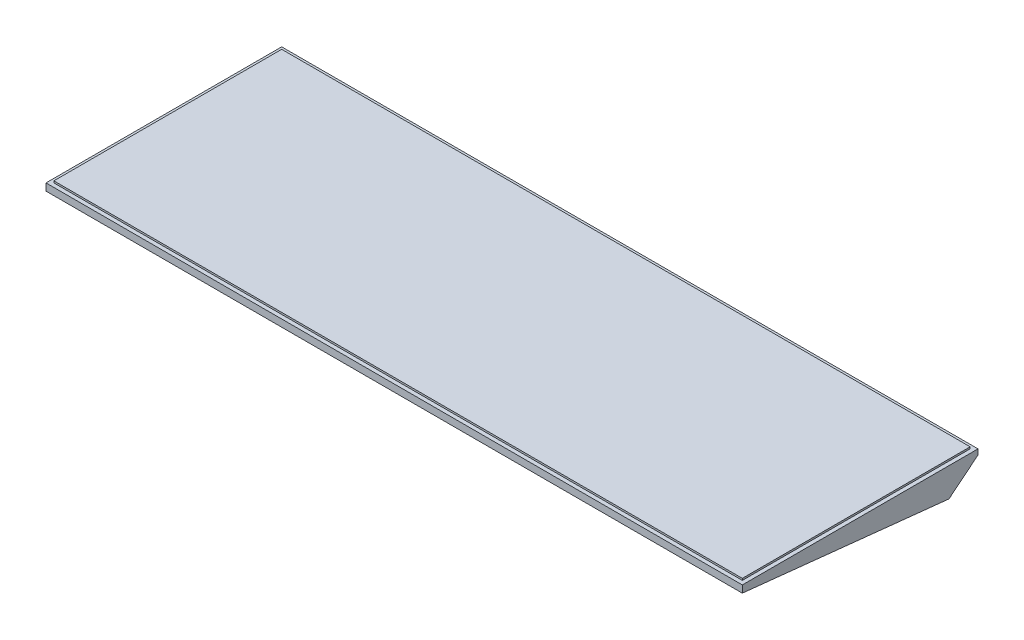
from build123d import *

# Parameters (mm, degrees)
SKETCH1_W               = 390
SKETCH1_H               = 132
BOSS_EXTRUDE1_DEPTH     = 40
CUT_EXTRUDE1_DEPTH      = 414.67136715
CUT_EXTRUDE1_DEPTH_BACK = 414.67136715
SKETCH3_W               = 385.6
SKETCH3_H               = 127.6
BOSS_EXTRUDE2_DEPTH     = 1
SKETCH4_R               = 1
CUT_EXTRUDE2_DEPTH      = 1


with BuildPart() as part:
    # Sketch1 → Boss-Extrude1 (new body)
    with BuildSketch(Plane(origin=(0, 0, 0), x_dir=(1, 0, 0), z_dir=(0, 1, 0))):
        with Locations((195, 66)):
            Rectangle(SKETCH1_W, SKETCH1_H)
    extrude(amount=BOSS_EXTRUDE1_DEPTH)

    # Sketch2 → Cut-Extrude1 (cut, two sides: drawn at the far end of the back side and taken through both)
    with BuildSketch(Plane.ZY.offset(-CUT_EXTRUDE1_DEPTH_BACK)):
        Polygon((282.618385439, 65.704389274), (0, 36), (-115.742540409, 23.834968803), (-132, 37), (-352.845551918, 215.837201746), (-483.52472151, -337.285718369), (151.939215847, -487.418530841), align=None)
    extrude(amount=CUT_EXTRUDE1_DEPTH + CUT_EXTRUDE1_DEPTH_BACK, mode=Mode.SUBTRACT)

    # Sketch3 → Boss-Extrude2 (add)
    with BuildSketch(Plane(origin=(0, 40, 0), x_dir=(1, 0, 0), z_dir=(0, 1, 0))):
        with Locations((195, 66)):
            Rectangle(SKETCH3_W, SKETCH3_H)
    extrude(amount=BOSS_EXTRUDE2_DEPTH)

    # Sketch4 → Cut-Extrude2 (cut)
    with BuildSketch(Plane(origin=(0, 35.606656813, -3.742410435), x_dir=(1, 0, 0), z_dir=(0, -0.9945218953682742, 0.10452846326764668))):
        with BuildLine():
            ThreePointArc((195.9, -65.236975322), (196.9, -66.236975322), (197.9, -65.236975322))
            Line((197.9, -65.236975322), (197.9, -51.236975322))
            ThreePointArc((197.9, -51.236975322), (196.9, -50.236975322), (195.9, -51.236975322))
            Line((195.9, -51.236975322), (195.9, -60.236975322))
            Line((195.9, -60.236975322), (193.9, -60.236975322))
            ThreePointArc((193.9, -60.236975322), (192.9, -61.236975322), (193.9, -62.236975322))
            Line((193.9, -62.236975322), (195.9, -62.236975322))
            Line((195.9, -62.236975322), (195.9, -65.236975322))
        make_face()
        with BuildLine():
            ThreePointArc((200.4, -57.736975322), (201.4, -58.736975322), (202.4, -57.736975322))
            Line((202.4, -57.736975322), (202.4, -47.236975322))
            ThreePointArc((202.4, -47.236975322), (201.4, -46.236975322), (200.4, -47.236975322))
            Line((200.4, -47.236975322), (200.4, -57.736975322))
        make_face()
        with BuildLine():
            ThreePointArc((191.1, -57.736975322), (192.1, -58.736975322), (193.1, -57.736975322))
            Line((193.1, -57.736975322), (193.1, -51.736975322))
            ThreePointArc((193.1, -51.736975322), (192.1, -50.736975322), (191.1, -51.736975322))
            Line((191.1, -51.736975322), (191.1, -57.736975322))
        make_face()
        with BuildLine():
            ThreePointArc((187.6, -57.736975322), (188.6, -58.736975322), (189.6, -57.736975322))
            Line((189.6, -57.736975322), (189.6, -51.736975322))
            ThreePointArc((189.6, -51.736975322), (188.6, -50.736975322), (187.6, -51.736975322))
            Line((187.6, -51.736975322), (187.6, -57.736975322))
        make_face()
        with BuildLine():
            ThreePointArc((184.1, -57.736975322), (185.1, -58.736975322), (186.1, -57.736975322))
            Line((186.1, -57.736975322), (186.1, -51.736975322))
            ThreePointArc((186.1, -51.736975322), (185.1, -50.736975322), (184.1, -51.736975322))
            Line((184.1, -51.736975322), (184.1, -57.736975322))
        make_face()
        with BuildLine():
            ThreePointArc((203.9, -49.736975322), (204.9, -50.736975322), (205.9, -49.736975322))
            Line((205.9, -49.736975322), (205.9, -47.236975322))
            ThreePointArc((205.9, -47.236975322), (204.9, -46.236975322), (203.9, -47.236975322))
            Line((203.9, -47.236975322), (203.9, -49.736975322))
        make_face()
        with Locations((201.4, -61.236975322)):
            Circle(SKETCH4_R)
    extrude(amount=-CUT_EXTRUDE2_DEPTH, mode=Mode.SUBTRACT)


solid = part.part
